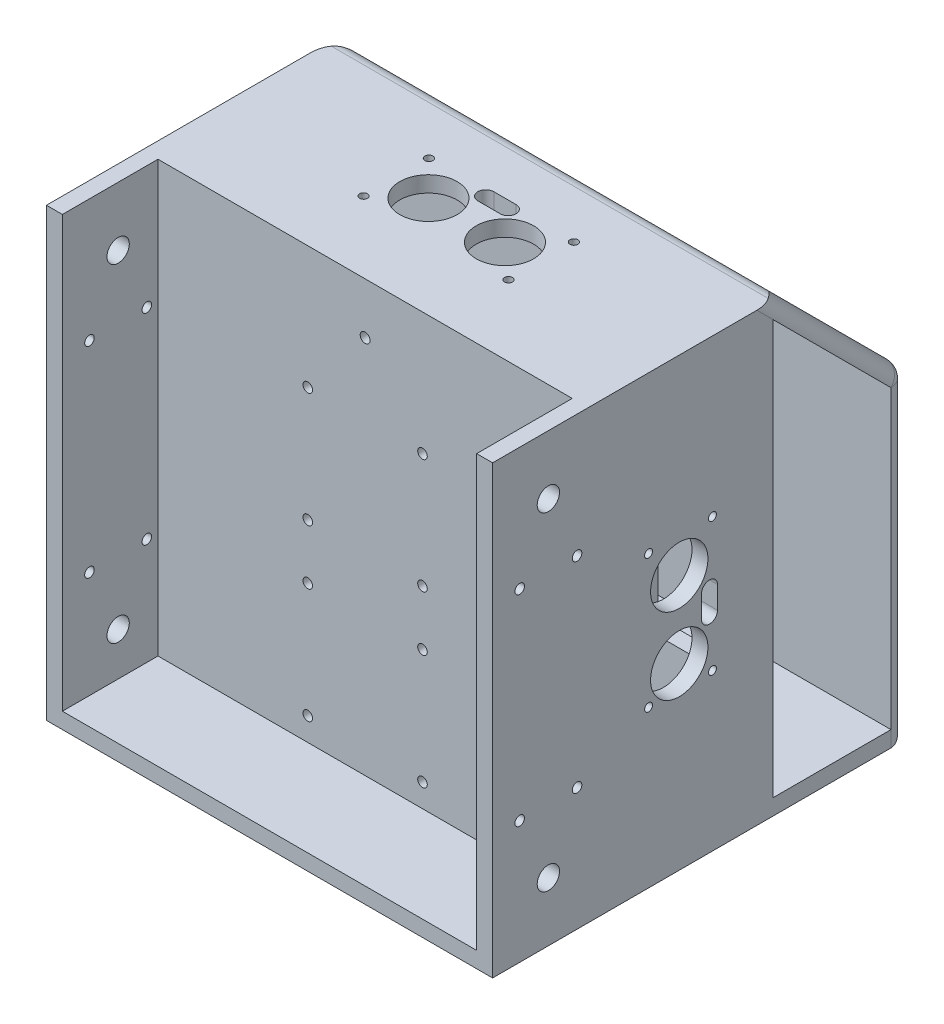
from build123d import *

# Parameters (mm, degrees)
SKETCH1_W                = 140
SKETCH1_H                = 100
SKETCH1_W_2              = 50
SKETCH1_H_2              = 25
SKETCH1_R                = 1.25
SKETCH1_R_2              = 9
BOSS_EXTRUDE3_DEPTH      = 140
CUT_EXTRUDE2_DEPTH       = 140
CUT_EXTRUDE2_DEPTH_BACK  = 140
CUT_EXTRUDE3_DEPTH       = 140
CUT_EXTRUDE3_DEPTH_BACK  = 140
SKETCH6_R                = 1.5
SKETCH6_W                = 73
SKETCH6_H                = 26
SKETCH6_W_2              = 42
SKETCH6_H_2              = 3.5
CUT_EXTRUDE4_DEPTH       = 140
CUT_EXTRUDE4_DEPTH_BACK  = 140
SKETCH9_W                = 103.269771069
SKETCH9_H                = 70.807332484
BOSS_EXTRUDE4_DEPTH      = 5
SKETCH14_W               = 5
SKETCH14_H               = 130
BOSS_EXTRUDE5_DEPTH      = 140
SKETCH16_W               = 30.999918233
SKETCH16_H               = 68
SKETCH16_R               = 1.5
CUT_EXTRUDE6_DEPTH       = 10
SKETCH27_W               = 47.928932188
SKETCH27_H               = 130
BOSS_EXTRUDE7_DEPTH      = 5
SKETCH31_W               = 47.928932188
SKETCH31_H               = 130
BOSS_EXTRUDE8_DEPTH      = 5
SKETCH33_W               = 47.928932188
SKETCH33_H               = 130
BOSS_EXTRUDE9_DEPTH      = 5
CUT_EXTRUDE7_DEPTH       = 1140
CUT_EXTRUDE7_DEPTH_BACK  = 140
SKETCH38_R               = 9
SKETCH38_R_2             = 1.25
BOSS_EXTRUDE10_DEPTH     = 30
CUT_EXTRUDE8_DEPTH       = 160
CUT_EXTRUDE8_DEPTH_BACK  = 160
SKETCH41_R               = 1.5
SKETCH41_R_2             = 3.5
CUT_EXTRUDE9_DEPTH       = 5
CUT_EXTRUDE9_DEPTH_BACK  = 5
SKETCH43_R               = 1.55
SKETCH12_R               = 1.5
CUT_EXTRUDE10_DEPTH      = 5
CUT_EXTRUDE11_DEPTH      = 5
CUT_EXTRUDE11_DEPTH_BACK = 5
SKETCH16_4_W             = 30.999918233
SKETCH16_4_H             = 68
SKETCH51_W               = 0.897435897
SKETCH51_H               = 10
CUT_EXTRUDE17_DEPTH      = 5
FILLET3_R                = 5


with BuildPart() as part:
    # Sketch1 → Boss-Extrude3 (new body)
    # profile 1 of 2: a face of its own
    with BuildSketch(Plane(origin=(0, 0, 0), x_dir=(1, 0, 0), z_dir=(0, 1, 0))):
        with Locations((0, 17.5)):
            Rectangle(SKETCH1_W, SKETCH1_H)
        Rectangle(SKETCH1_W_2, SKETCH1_H_2, mode=Mode.SUBTRACT)
    # profile 2 of 2: a face of its own
    with BuildSketch(Plane(origin=(0, 0, 0), x_dir=(1, 0, 0), z_dir=(0, 1, 0))):
        Rectangle(SKETCH1_W_2, SKETCH1_H_2)
        with Locations(Location((-22.75, 10.25, 0), (0, 0, 270))):
            Circle(SKETCH1_R, mode=Mode.SUBTRACT)
        with Locations(Location((22.75, 10.25, 0), (0, 0, 270))):
            Circle(SKETCH1_R, mode=Mode.SUBTRACT)
        with Locations(Location((12, -0.631614997, 0), (0, 0, 270))):
            Circle(SKETCH1_R_2, mode=Mode.SUBTRACT)
        with Locations(Location((-12, -0.631614997, 0), (0, 0, 270))):
            Circle(SKETCH1_R_2, mode=Mode.SUBTRACT)
        with Locations(Location((-22.75, -10.25, 0), (0, 0, 270))):
            Circle(SKETCH1_R, mode=Mode.SUBTRACT)
        with Locations(Location((22.75, -10.25, 0), (0, 0, 270))):
            Circle(SKETCH1_R, mode=Mode.SUBTRACT)
        with BuildLine():
            ThreePointArc((-3.5, 11.367051691), (-6, 8.867051691), (-3.5, 6.367051691))
            Line((-3.5, 6.367051691), (0, 6.367051691))
            Line((0, 6.367051691), (3.5, 6.367051691))
            ThreePointArc((3.5, 6.367051691), (6, 8.867051691), (3.5, 11.367051691))
            Line((3.5, 11.367051691), (-3.5, 11.367051691))
        make_face(mode=Mode.SUBTRACT)
    extrude(amount=BOSS_EXTRUDE3_DEPTH)

    # Sketch4 → Cut-Extrude2 (cut, two sides: drawn at the far end of the back side and taken through both)
    with BuildSketch(Plane(origin=(70, 0, 0), x_dir=(0, 0, -1), z_dir=(1, 0, 0)).offset(-CUT_EXTRUDE2_DEPTH_BACK)):
        Polygon((67.5, 140), (27.5, 140), (67.5, 100), align=None)
    extrude(amount=CUT_EXTRUDE2_DEPTH + CUT_EXTRUDE2_DEPTH_BACK, mode=Mode.SUBTRACT)

    # Sketch6 → Cut-Extrude3 (cut, two sides: drawn at the far end of the back side and taken through both)
    with BuildSketch(Plane(origin=(0, 83.75, -83.75), x_dir=(1, 0, 0), z_dir=(0, 0.7071067811865515, -0.7071067811865437)).offset(-CUT_EXTRUDE3_DEPTH_BACK)):
        with Locations(Location((41, -33.765241636, 0), (0, 0, 90))):
            Circle(SKETCH6_R)
        with Locations(Location((-41, -33.765241636, 0), (0, 0, 90))):
            Circle(SKETCH6_R)
        with Locations(Location((41, -68.765241636, 0), (0, 0, 90))):
            Circle(SKETCH6_R)
        with Locations(Location((-41, -68.765241636, 0), (0, 0, 90))):
            Circle(SKETCH6_R)
        with Locations((0, -51.265241636)):
            Rectangle(SKETCH6_W, SKETCH6_H)
        with Locations((-15.906759621, -33.015241636)):
            Rectangle(SKETCH6_W_2, SKETCH6_H_2)
    extrude(amount=CUT_EXTRUDE3_DEPTH + CUT_EXTRUDE3_DEPTH_BACK, mode=Mode.SUBTRACT)

    # Sketch7 → Cut-Extrude4 (cut, two sides: drawn at the far end of the back side and taken through both)
    with BuildSketch(Plane(origin=(70, 0, 0), x_dir=(0, 0, -1), z_dir=(1, 0, 0)).offset(-CUT_EXTRUDE4_DEPTH_BACK)):
        Polygon((62.5, 5), (62.5, 97.928932188), (25.428932188, 135), (-27.5, 135), (-27.5, 5), align=None)
    extrude(amount=CUT_EXTRUDE4_DEPTH + CUT_EXTRUDE4_DEPTH_BACK, mode=Mode.SUBTRACT)

    # Sketch9 → Boss-Extrude4 (add)
    with BuildSketch(Plane.XY.offset(32.5)):
        with Locations((1.307212293, 42.839120831)):
            Rectangle(SKETCH9_W, SKETCH9_H)
    extrude(amount=-BOSS_EXTRUDE4_DEPTH)



with BuildPart() as body_2:
    # Sketch14 → Boss-Extrude5 (new body)
    with BuildSketch(Plane(origin=(70, 0, 0), x_dir=(0, 0, -1), z_dir=(1, 0, 0))):
        with Locations((22.928932188, 70)):
            Rectangle(SKETCH14_W, SKETCH14_H)
    extrude(amount=-BOSS_EXTRUDE5_DEPTH)

    # Sketch16 → Cut-Extrude6 (cut)
    with BuildSketch(Plane.XY.offset(-20.428932188)):
        with Locations((-49.499959117, 70)):
            Rectangle(SKETCH16_W, SKETCH16_H)
        with Locations(Location((-23, 49.5, 0), (0, 0, 180))):
            Circle(SKETCH16_R)
        with Locations((23, 49.5)):
            Circle(SKETCH16_R)
        with Locations((20, 102)):
            Circle(SKETCH16_R)
        with Locations((-10, 102)):
            Circle(SKETCH16_R)
    extrude(amount=-CUT_EXTRUDE6_DEPTH, mode=Mode.SUBTRACT)


with BuildPart() as part_1:
    add(part.part)

    add(body_2.part)  # Boss-Extrude7 merges body 2
    # Sketch27 → Boss-Extrude7 (add)
    with BuildSketch(Plane.ZY.offset(70)):
        with Locations((3.535533906, 70)):
            Rectangle(SKETCH27_W, SKETCH27_H)
    extrude(amount=-BOSS_EXTRUDE7_DEPTH)

    # Sketch31 → Boss-Extrude8 (add)
    with BuildSketch(Plane(origin=(-65, 0, 0), x_dir=(0, 0, -1), z_dir=(1, 0, 0))):
        with Locations((-3.535533906, 70)):
            Rectangle(SKETCH31_W, SKETCH31_H)
    extrude(amount=BOSS_EXTRUDE8_DEPTH)

    # Sketch33 → Boss-Extrude9 (add)
    with BuildSketch(Plane(origin=(70, 0, 0), x_dir=(0, 0, -1), z_dir=(1, 0, 0))):
        with Locations((-3.535533906, 70)):
            Rectangle(SKETCH33_W, SKETCH33_H)
    extrude(amount=-BOSS_EXTRUDE9_DEPTH)

    # Sketch38 → Cut-Extrude7 (cut, two sides: drawn at the far end of the back side and taken through both)
    with BuildSketch(Plane(origin=(70, 0, 0), x_dir=(0, 0, -1), z_dir=(1, 0, 0)).offset(-CUT_EXTRUDE7_DEPTH_BACK)):
        with Locations((-3.934374771, 56.14843554)):
            Circle(SKETCH38_R)
        with Locations((-3.934374771, 80.14843554)):
            Circle(SKETCH38_R)
        with Locations((6.481691963, 90.89843554)):
            Circle(SKETCH38_R_2)
        with Locations((-13.552759774, 90.89843554)):
            Circle(SKETCH38_R_2)
        with Locations((6.481691963, 49.10156446)):
            Circle(SKETCH38_R_2)
        with Locations((-13.552759774, 49.10156446)):
            Circle(SKETCH38_R_2)
        with BuildLine():
            Line((3.064291917, 64.64843554), (3.064291917, 68.14843554))
            Line((3.064291917, 68.14843554), (3.064291917, 71.64843554))
            ThreePointArc((3.064291917, 71.64843554), (5.564291917, 74.14843554), (8.064291917, 71.64843554))
            Line((8.064291917, 71.64843554), (8.064291917, 64.64843554))
            ThreePointArc((8.064291917, 64.64843554), (5.564291917, 62.14843554), (3.064291917, 64.64843554))
        make_face()
    extrude(amount=CUT_EXTRUDE7_DEPTH + CUT_EXTRUDE7_DEPTH_BACK, mode=Mode.SUBTRACT)

    # Sketch39 → Boss-Extrude10 (add)
    with BuildSketch(Plane.XY.offset(32.5)):
        Polygon((-70, 140), (-70, 0), (70, 0), (70, 140), (65, 140), (65, 5), (-65, 5), (-65, 140), align=None)
    extrude(amount=BOSS_EXTRUDE10_DEPTH)

    # Sketch41 → Cut-Extrude8 (cut, two sides: drawn at the far end of the back side and taken through both)
    with BuildSketch(Plane.ZY.offset(70).offset(-CUT_EXTRUDE8_DEPTH_BACK)):
        with Locations(Location((36, 38.5, 0), (0, 0, 180))):
            Circle(SKETCH41_R)
        with Locations(Location((45, 18.5, 0), (0, 0, 180))):
            Circle(SKETCH41_R_2)
        with Locations(Location((45, 121.5, 0), (0, 0, 180))):
            Circle(SKETCH41_R_2)
        with Locations(Location((54, 101.5, 0), (0, 0, 180))):
            Circle(SKETCH41_R)
        with Locations(Location((36, 101.5, 0), (0, 0, 180))):
            Circle(SKETCH41_R)
        with Locations(Location((54, 38.5, 0), (0, 0, 180))):
            Circle(SKETCH41_R)
    extrude(amount=CUT_EXTRUDE8_DEPTH + CUT_EXTRUDE8_DEPTH_BACK, mode=Mode.SUBTRACT)

    # Sketch43 → Cut-Extrude9 (cut, two sides: drawn at the far end of the back side and taken through both)
    with BuildSketch(Plane.XY.offset(32.5).offset(-CUT_EXTRUDE9_DEPTH_BACK)):
        with Locations(Location((0, 124, 0), (0, 0, 180))):
            Circle(SKETCH43_R)
    extrude(amount=CUT_EXTRUDE9_DEPTH + CUT_EXTRUDE9_DEPTH_BACK, mode=Mode.SUBTRACT)

    # Sketch12 → Cut-Extrude10 (cut)
    with BuildSketch(Plane.XY.offset(32.5)):
        with Locations((-18, 101.5)):
            Circle(SKETCH12_R)
        with Locations((18, 101.5)):
            Circle(SKETCH12_R)
        with Locations((-18, 65.5)):
            Circle(SKETCH12_R)
        with Locations((18, 48.28323807)):
            Circle(SKETCH12_R)
        with Locations((18, 12.28323807)):
            Circle(SKETCH12_R)
        with Locations((-18, 12.28323807)):
            Circle(SKETCH12_R)
        with Locations(Location((18, 65.5, 0), (0, 0, 180))):
            Circle(SKETCH12_R)
        with Locations(Location((-18, 48.28323807, 0), (0, 0, 180))):
            Circle(SKETCH12_R)
    extrude(amount=-CUT_EXTRUDE10_DEPTH, mode=Mode.SUBTRACT)

    # Sketch16<4> → Cut-Extrude11 (cut, two sides: drawn at the far end of the back side and taken through both)
    with BuildSketch(Plane.XY.offset(-20.428932188).offset(-CUT_EXTRUDE11_DEPTH_BACK)):
        with Locations((-49.499959117, 70)):
            Rectangle(SKETCH16_4_W, SKETCH16_4_H)
        with Locations((49.499959117, 70)):
            Rectangle(SKETCH16_4_W, SKETCH16_4_H)
    extrude(amount=CUT_EXTRUDE11_DEPTH + CUT_EXTRUDE11_DEPTH_BACK, mode=Mode.SUBTRACT)

    # Sketch51 → Cut-Extrude17 (cut)
    with BuildSketch(Plane(origin=(0, 83.75, -83.75), x_dir=(1, 0, 0), z_dir=(0, 0.7071067811865515, -0.7071067811865437))):
        Polygon((55.549151417, -30.941309603), (55.549151417, -29.915668577), (60.805561673, -29.915668577), (60.805561673, -30.941309603), (58.626074494, -30.941309603), (58.626074494, -39.915668577), (57.728638596, -39.915668577), (57.728638596, -30.941309603), align=None)
        with BuildLine():
            Line((55.677356545, -55.653248705), (56.522709109, -55.146437808))
            add(Edge.make_bspline(
                [(56.522709109, -55.146437808), (56.601332644, -55.278050336), (56.751972303, -55.530214862), (57.003261901, -55.87095212), (57.263641647, -56.160558282), (57.535039743, -56.397348589), (57.815799594, -56.58377398), (58.107754034, -56.715780357), (58.409919207, -56.798111715), (58.615558697, -56.808111962), (58.71822193, -56.813104474)],
                knots=[0, 0, 0, 0, 1.272034388, 2.437168799, 3.508375237, 4.49857839, 5.41946034, 6.295179144, 7.148887113, 8, 8, 8, 8], degree=3))
            add(Edge.make_bspline(
                [(58.71822193, -56.813104474), (58.805898674, -56.810662553), (58.979718025, -56.805821438), (59.235610148, -56.759304861), (59.484129583, -56.687841635), (59.720154262, -56.585496117), (59.940427447, -56.461671872), (60.133589434, -56.312111365), (60.300578328, -56.144665062), (60.437175799, -55.957857478), (60.541975899, -55.756951339), (60.622524666, -55.550734335), (60.667224877, -55.335966997), (60.673958458, -55.191365675), (60.677356545, -55.118392936)],
                knots=[0, 0, 0, 0, 1.095163259, 2.171163733, 3.241058638, 4.321873601, 5.38011039, 6.391990106, 7.366004449, 8.327778327, 9.272591725, 10.192022065, 11.087607919, 12, 12, 12, 12], degree=3))
            add(Edge.make_bspline(
                [(60.677356545, -55.118392936), (60.673144229, -55.035133365), (60.664581205, -54.865878825), (60.592205548, -54.616165531), (60.478350557, -54.369043902), (60.373314432, -54.216183143), (60.318782827, -54.136822423)],
                knots=[0, 0, 0, 0, 0.938893495, 1.908633276, 2.914225137, 4, 4, 4, 4], degree=3))
            add(Edge.make_bspline(
                [(60.318782827, -54.136822423), (60.274009644, -54.079545784), (60.180013946, -53.959300646), (60.018421053, -53.780314258), (59.828803583, -53.595690204), (59.617650569, -53.398378613), (59.377270315, -53.197556337), (59.115191703, -52.983646971), (58.824723534, -52.764785323), (58.621010687, -52.618006564), (58.515898212, -52.542271141)],
                knots=[0, 0, 0, 0, 0.722233717, 1.516239348, 2.393582979, 3.351407094, 4.387010283, 5.505090956, 6.712668013, 8, 8, 8, 8], degree=3))
            add(Edge.make_bspline(
                [(58.515898212, -52.542271141), (58.410686794, -52.467332319), (58.209530575, -52.324054999), (57.92822034, -52.111414187), (57.676664731, -51.917003131), (57.455981827, -51.738991668), (57.266268693, -51.577355655), (57.106030376, -51.433647257), (56.979348784, -51.30397994), (56.908904268, -51.219861821), (56.877276417, -51.182094859)],
                knots=[0, 0, 0, 0, 1.452282411, 2.77665338, 3.964542531, 5.026858415, 5.96415736, 6.766646006, 7.446254459, 8, 8, 8, 8], degree=3))
            add(Edge.make_bspline(
                [(56.877276417, -51.182094859), (56.833069145, -51.123234754), (56.746129611, -51.007478457), (56.631369596, -50.826550292), (56.53382913, -50.641340963), (56.457365324, -50.451352778), (56.392976128, -50.259252981), (56.349667754, -50.062535136), (56.322549477, -49.862081941), (56.319772373, -49.727186225), (56.318382186, -49.659658962)],
                knots=[0, 0, 0, 0, 1.068054152, 2.10047183, 3.106115577, 4.101338837, 5.06977816, 6.043150881, 7.020423561, 8, 8, 8, 8], degree=3))
            add(Edge.make_bspline(
                [(56.318382186, -49.659658962), (56.322111355, -49.553859606), (56.329489983, -49.344522281), (56.391891461, -49.038719908), (56.490385443, -48.746758716), (56.628370837, -48.471529191), (56.806248988, -48.220197817), (57.012094629, -47.989873569), (57.257270304, -47.796249048), (57.526277799, -47.627071738), (57.820724577, -47.494654809), (58.129270015, -47.394766294), (58.452404506, -47.338168415), (58.671270605, -47.33004623), (58.782324494, -47.325924987)],
                knots=[0, 0, 0, 0, 1.005424448, 1.989358655, 2.955360095, 3.929531133, 4.905563448, 5.876582895, 6.856512386, 7.866279853, 8.892233794, 9.918561126, 10.94386622, 12, 12, 12, 12], degree=3))
            add(Edge.make_bspline(
                [(58.782324494, -47.325924987), (58.90016478, -47.32998942), (59.1345115, -47.338072281), (59.479223544, -47.408350942), (59.811111305, -47.524638575), (60.078092062, -47.65660617), (60.287042809, -47.788410214), (60.446393474, -47.908466855), (60.607871904, -48.046681451), (60.772780633, -48.203422154), (60.938325374, -48.380127157), (61.106963809, -48.575586269), (61.279090291, -48.788605), (61.38982132, -48.940675002), (61.446587314, -49.018633321)],
                knots=[0, 0, 0, 0, 1.286793592, 2.559021753, 3.825965368, 5.121522368, 5.803751409, 6.523245864, 7.299691795, 8.125521123, 9.008227632, 9.944561021, 10.946284179, 12, 12, 12, 12], degree=3))
            Line((61.446587314, -49.018633321), (60.635289237, -49.633617295))
            add(Edge.make_bspline(
                [(60.635289237, -49.633617295), (60.586300859, -49.570506751), (60.491960696, -49.448970599), (60.34873359, -49.27876684), (60.213737453, -49.123291184), (60.080736311, -48.988247961), (59.956754507, -48.866241866), (59.836420101, -48.761785418), (59.721464811, -48.673855145), (59.576559352, -48.580016402), (59.394508729, -48.486997821), (59.165981482, -48.408286169), (58.927163554, -48.360985992), (58.764507464, -48.354732028), (58.682164237, -48.351566013)],
                knots=[0, 0, 0, 0, 1.181633172, 2.275549214, 3.290209073, 4.226197932, 5.078386478, 5.862611352, 6.581680152, 7.217281963, 8.414376989, 9.595101626, 10.782541182, 12, 12, 12, 12], degree=3))
            add(Edge.make_bspline(
                [(58.682164237, -48.351566013), (58.578859888, -48.355028013), (58.379647181, -48.361704153), (58.096817935, -48.434618397), (57.842263863, -48.549423712), (57.623542249, -48.71032365), (57.4414366, -48.900955057), (57.309706718, -49.120323215), (57.230420533, -49.362558651), (57.220745449, -49.531534812), (57.215818083, -49.617591654)],
                knots=[0, 0, 0, 0, 1.14458467, 2.207223713, 3.21896685, 4.227309161, 5.202851033, 6.127160689, 7.046193047, 8, 8, 8, 8], degree=3))
            add(Edge.make_bspline(
                [(57.215818083, -49.617591654), (57.216941302, -49.671167307), (57.219189577, -49.77840622), (57.250546142, -49.936838854), (57.290829939, -50.094871252), (57.35466603, -50.251792917), (57.442795468, -50.410348229), (57.558524542, -50.573267479), (57.704276863, -50.741986647), (57.815925469, -50.851722), (57.874872571, -50.909658962)],
                knots=[0, 0, 0, 0, 0.858281714, 1.717966888, 2.583508476, 3.4729293, 4.427298488, 5.488583878, 6.674047936, 8, 8, 8, 8], degree=3))
            add(Edge.make_bspline(
                [(57.874872571, -50.909658962), (57.896762206, -50.929193321), (57.948766969, -50.975602488), (58.043841043, -51.051580432), (58.169391895, -51.145302639), (58.322141041, -51.2612664), (58.504904932, -51.395784864), (58.717703664, -51.547138041), (58.958165186, -51.720239353), (59.128799231, -51.841260897), (59.219023212, -51.90525191)],
                knots=[0, 0, 0, 0, 0.420754252, 0.999615792, 1.744751191, 2.668019286, 3.750313428, 4.999500688, 6.413464383, 8, 8, 8, 8], degree=3))
            add(Edge.make_bspline(
                [(59.219023212, -51.90525191), (59.327554393, -51.984227223), (59.537709982, -52.137151971), (59.836731639, -52.366911057), (60.107856805, -52.591618967), (60.352037387, -52.809840702), (60.571685696, -53.019920968), (60.764364898, -53.224387197), (60.932038271, -53.421774548), (61.112550324, -53.67483905), (61.297001236, -53.985642147), (61.455405543, -54.366437115), (61.555286536, -54.748712316), (61.568348009, -55.005646135), (61.574792442, -55.132415372)],
                knots=[0, 0, 0, 0, 1.163667725, 2.253281268, 3.268753668, 4.215851969, 5.092017293, 5.902905408, 6.650798638, 7.335211899, 8.59617414, 9.77448103, 10.901945474, 12, 12, 12, 12], degree=3))
            add(Edge.make_bspline(
                [(61.574792442, -55.132415372), (61.572914905, -55.222067844), (61.56919629, -55.399631797), (61.526450822, -55.660360588), (61.463823208, -55.913591644), (61.369431111, -56.156194822), (61.254222087, -56.39260843), (61.108032808, -56.616631003), (60.93858228, -56.833220713), (60.744200094, -57.036602117), (60.531497516, -57.223305534), (60.30668696, -57.389388567), (60.069400466, -57.527869491), (59.820925275, -57.640871896), (59.561204313, -57.729253375), (59.290324931, -57.793290144), (59.007840613, -57.832592175), (58.815839237, -57.836671494), (58.71822193, -57.8387455)],
                knots=[0, 0, 0, 0, 0.983748083, 1.948392443, 2.894712957, 3.844097841, 4.80183111, 5.778335162, 6.776009319, 7.81870978, 8.863265674, 9.881300176, 10.883814829, 11.87499822, 12.874611388, 13.892143829, 14.928324115, 16, 16, 16, 16], degree=3))
            add(Edge.make_bspline(
                [(58.71822193, -57.8387455), (58.642692378, -57.837284981), (58.492584492, -57.834382337), (58.270557401, -57.808721536), (58.053015718, -57.772415526), (57.842689198, -57.714775326), (57.636868022, -57.644841106), (57.436447352, -57.558731584), (57.241330055, -57.45553958), (57.050422675, -57.337553795), (56.864210748, -57.200245954), (56.684440839, -57.040321678), (56.505214595, -56.862191664), (56.331822034, -56.661018626), (56.160755908, -56.440052675), (55.995389023, -56.197226436), (55.832298401, -55.933862568), (55.729968493, -55.748533752), (55.677356545, -55.653248705)],
                knots=[0, 0, 0, 0, 0.915332311, 1.819136955, 2.706846663, 3.586547465, 4.459518054, 5.340707479, 6.227863349, 7.133153174, 8.059268498, 9.028702269, 10.047606654, 11.120612155, 12.245963614, 13.433783089, 14.680604001, 16, 16, 16, 16], degree=3))
        make_face()
        with Locations((57.15171552, -70.24900191)):
            Rectangle(SKETCH51_W, SKETCH51_H)
    extrude(amount=-CUT_EXTRUDE17_DEPTH, mode=Mode.SUBTRACT)

    # Fillet3
    fillet3_edges = [part_1.edges().sort_by_distance(p)[0] for p in [
        (0, 0, -67.5),
        (0, 140, -27.5),
        (-70, 50, -67.5),
        (70, 50, -67.5),
        (0, 100, -67.5),
        (70, 120, -47.5),
        (-70, 120, -47.5),
    ]]
    fillet(fillet3_edges, radius=FILLET3_R - 0.0001)  # a hair under: the kernel refuses the full size


solid = part_1.part
